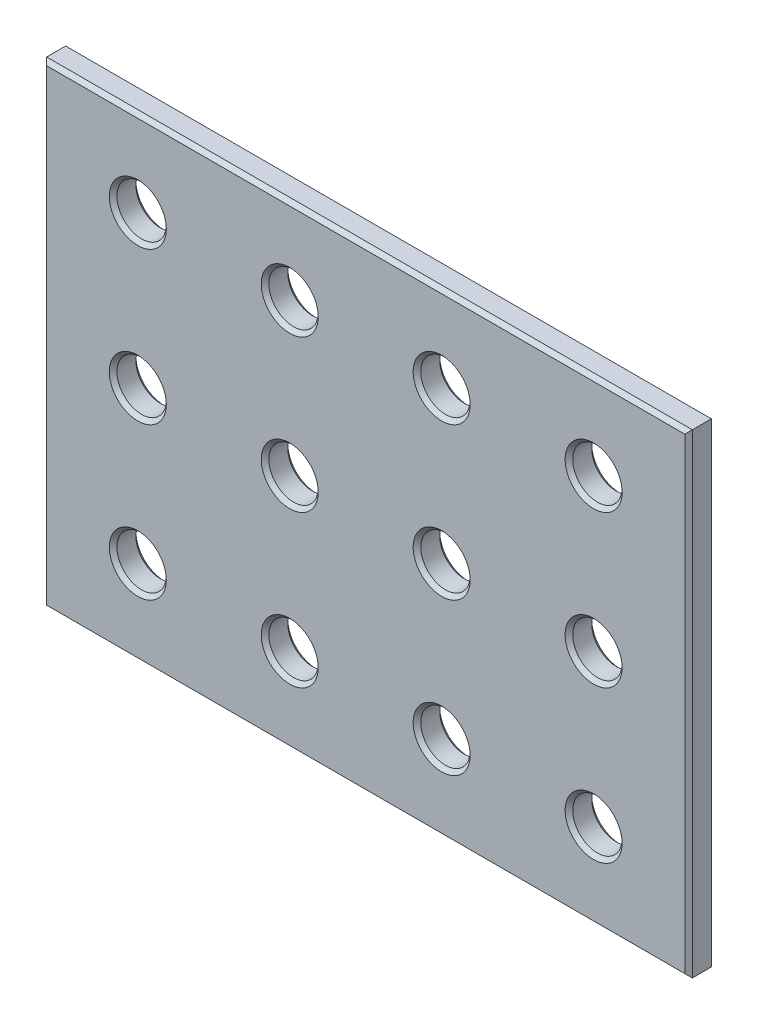
from build123d import *

# Parameters (mm, degrees)
SKETCH_1_W        = 340
SKETCH_1_H        = 250
SKETCH_1_R        = 13
EXTRUDE_448_DEPTH = 14
CHAMFER_1_SIZE    = 2


with BuildPart() as part:
    # 草图1 → Extrude 448 (new body)
    with BuildSketch(Plane.XY):
        Rectangle(SKETCH_1_W, SKETCH_1_H)
        with Locations((-120, 80)):
            Circle(SKETCH_1_R, mode=Mode.SUBTRACT)
        with Locations((-40, 80)):
            Circle(SKETCH_1_R, mode=Mode.SUBTRACT)
        with Locations((-40, 0)):
            Circle(SKETCH_1_R, mode=Mode.SUBTRACT)
        with Locations((-120, 0)):
            Circle(SKETCH_1_R, mode=Mode.SUBTRACT)
        with Locations((-40, -80)):
            Circle(SKETCH_1_R, mode=Mode.SUBTRACT)
        with Locations((-120, -80)):
            Circle(SKETCH_1_R, mode=Mode.SUBTRACT)
        with Locations((120, -80)):
            Circle(SKETCH_1_R, mode=Mode.SUBTRACT)
        with Locations((40, -80)):
            Circle(SKETCH_1_R, mode=Mode.SUBTRACT)
        with Locations((120, 0)):
            Circle(SKETCH_1_R, mode=Mode.SUBTRACT)
        with Locations((40, 0)):
            Circle(SKETCH_1_R, mode=Mode.SUBTRACT)
        with Locations((40, 80)):
            Circle(SKETCH_1_R, mode=Mode.SUBTRACT)
        with Locations((120, 80)):
            Circle(SKETCH_1_R, mode=Mode.SUBTRACT)
    extrude(amount=EXTRUDE_448_DEPTH)

    # 倒角1
    chamfer_1_edges = [part.edges().sort_by_distance(p)[0] for p in [
        (107, 80, 0),
        (27, 0, 0),
        (27, -80, 0),
        (-133, -80, 0),
        (-133, 0, 0),
        (-53, 80, 0),
        (0, -125, 0),
        (170, 0, 0),
        (0, 125, 0),
        (-170, 0, 0),
        (-133, 80, 0),
        (-53, 0, 0),
        (-53, -80, 0),
        (107, -80, 0),
        (107, 0, 0),
        (27, 80, 0),
        (107, 80, 14),
        (27, 0, 14),
        (27, -80, 14),
        (-133, -80, 14),
        (-133, 0, 14),
        (-53, 80, 14),
        (0, 125, 14),
        (170, 0, 14),
        (0, -125, 14),
        (-170, 0, 14),
        (-133, 80, 14),
        (-53, 0, 14),
        (-53, -80, 14),
        (107, -80, 14),
        (107, 0, 14),
        (27, 80, 14),
    ]]
    chamfer(chamfer_1_edges, length=CHAMFER_1_SIZE)


solid = part.part
